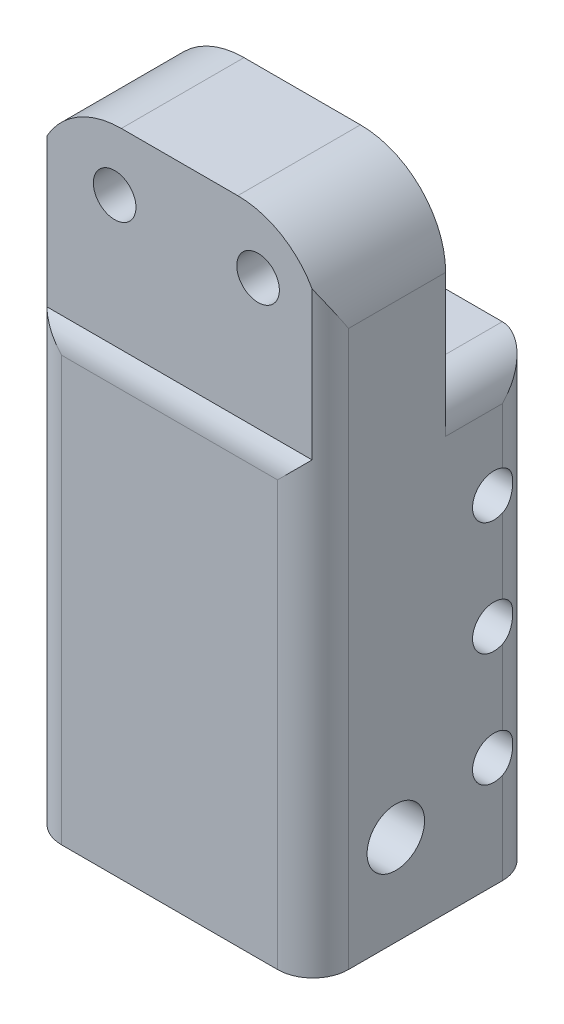
from build123d import *

# Parameters (mm, degrees)
CROQUIS1_W                 = 20.2
CROQUIS1_H                 = 15.83
SALIENTE_EXTRUIR1_DEPTH    = 31.6
CORTAR_EXTRUIR4_DEPTH      = 31.6
CORTAR_EXTRUIR5_DEPTH      = 35.649242416
CORTAR_EXTRUIR6_DEPTH      = 35.649242416
CORTAR_EXTRUIR6_DEPTH_BACK = 35.649242416
CROQUIS5_R                 = 2.025
CROQUIS6_R                 = 1.5
CORTAR_EXTRUIR7_DEPTH      = 39.814945709
CROQUIS10_W                = 20.2
CROQUIS10_H                = 8.639055001
SALIENTE_EXTRUIR4_DEPTH    = 13.5
CORTAR_EXTRUIR8_REACH      = 50.631
CROQUIS11_R                = 1.5
REDONDEO2_START            = -1
REDONDEO2_DEPTH            = 47
REDONDEO2_START_2          = -10
REDONDEO2_2_DEPTH          = 20
REDONDEO2_START_3          = -11
REDONDEO2_3_DEPTH          = 7.490944999
REDONDEO3_R                = 6


with BuildPart() as part:
    # Croquis1 → Saliente-Extruir1 (new body)
    with BuildSketch(Plane(origin=(0, 0, 0), x_dir=(1, 0, 0), z_dir=(0, 1, 0))):
        with Locations((0, 2.085)):
            Rectangle(CROQUIS1_W, CROQUIS1_H)
    extrude(amount=SALIENTE_EXTRUIR1_DEPTH)

    # Croquis2 → Cortar-Extruir4 (cut)
    with BuildSketch(Plane.XZ):
        with BuildLine():
            Line((2.78, 2.634482871), (2.78, -2.634482871))
            ThreePointArc((2.78, -2.634482871), (-3.83, 0), (2.78, 2.634482871))
        make_face()
    extrude(amount=-CORTAR_EXTRUIR4_DEPTH, mode=Mode.SUBTRACT)

    # Croquis4 → Cortar-Extruir5 (cut, through all)
    with BuildSketch(Plane.XZ):
        with BuildLine():
            Line((-0.4, -10), (-0.4, -3.809055001))
            ThreePointArc((-0.4, -3.809055001), (0, -3.83), (0.4, -3.809055001))
            Line((0.4, -3.809055001), (0.4, -10))
            Line((0.4, -10), (-0.4, -10))
        make_face()
    extrude(amount=-CORTAR_EXTRUIR5_DEPTH, mode=Mode.SUBTRACT)

    # Croquis5 → Cortar-Extruir6 (cut, two sides: drawn at the far end of the back side and taken through both)
    with BuildSketch(Plane(origin=(0, 0, 0), x_dir=(0, 0, -1), z_dir=(1, 0, 0)).offset(-CORTAR_EXTRUIR6_DEPTH_BACK)):
        with Locations((0, 6.405)):
            Circle(CROQUIS5_R)
    extrude(amount=CORTAR_EXTRUIR6_DEPTH + CORTAR_EXTRUIR6_DEPTH_BACK, mode=Mode.SUBTRACT)

    # Croquis6 → Cortar-Extruir7 (cut, through all)
    with BuildSketch(Plane(origin=(10.1, 0, 0), x_dir=(0, 0, -1), z_dir=(1, 0, 0))):
        with Locations((6.9045275, 23.8)):
            Circle(CROQUIS6_R)
        with Locations((6.9045275, 15.8)):
            Circle(CROQUIS6_R)
        with Locations((6.9045275, 7.8)):
            Circle(CROQUIS6_R)
    extrude(amount=-CORTAR_EXTRUIR7_DEPTH, mode=Mode.SUBTRACT)

    # Croquis10 → Saliente-Extruir4 (add)
    with BuildSketch(Plane(origin=(0, 31.6, 0), x_dir=(1, 0, 0), z_dir=(0, 1, 0))):
        with Locations((0, -0.810472499)):
            Rectangle(CROQUIS10_W, CROQUIS10_H)
    extrude(amount=SALIENTE_EXTRUIR4_DEPTH)

    # Croquis11 → Cortar-Extruir8 (cut, up to next)
    with BuildSketch(Plane.XY.offset(5.13), mode=Mode.PRIVATE) as cortar_extruir8_sk1:
        with Locations((-4.57, 40.8)):
            Circle(CROQUIS11_R)
    cortar_extruir8_tool1 = extrude(cortar_extruir8_sk1.sketch, amount=-CORTAR_EXTRUIR8_REACH, mode=Mode.PRIVATE) & part.part
    # Croquis11 → Cortar-Extruir8 (cut, up to next)
    with BuildSketch(Plane.XY.offset(5.13), mode=Mode.PRIVATE) as cortar_extruir8_sk2:
        with Locations((5.53, 40.8)):
            Circle(CROQUIS11_R)
    cortar_extruir8_tool2 = extrude(cortar_extruir8_sk2.sketch, amount=-CORTAR_EXTRUIR8_REACH, mode=Mode.PRIVATE) & part.part
    add(cortar_extruir8_tool1.solids().sort_by_distance((-4.57, 40.8, 5.13))[0], mode=Mode.SUBTRACT)
    add(cortar_extruir8_tool2.solids().sort_by_distance((5.53, 40.8, 5.13))[0], mode=Mode.SUBTRACT)

    # Redondeo2: read off the stored shape, not the designer's step
    # Redondeo2 outline → Redondeo2 (cut)
    with BuildSketch(Plane(origin=(0, 0, 0), x_dir=(1, 0, 0), z_dir=(0, 1, 0)).offset(REDONDEO2_START)):
        with BuildLine():
            Line((-10.1, -5.83), (-7.6, -5.83))
            ThreePointArc((-7.6, -5.83), (-9.367766953, -5.097766953), (-10.1, -3.33))
            Line((-10.1, -3.33), (-10.1, -5.83))
        make_face()
        with BuildLine():
            ThreePointArc((7.6, 10), (9.367766953, 9.267766953), (10.1, 7.5))
            Line((10.1, 7.5), (10.1, 10))
            Line((10.1, 10), (7.6, 10))
        make_face()
        with BuildLine():
            ThreePointArc((10.1, -3.33), (9.367766953, -5.097766953), (7.6, -5.83))
            Line((7.6, -5.83), (10.1, -5.83))
            Line((10.1, -5.83), (10.1, -3.33))
        make_face()
        with BuildLine():
            Line((-10.1, 10), (-10.1, 7.5))
            ThreePointArc((-10.1, 7.5), (-9.367766953, 9.267766953), (-7.6, 10))
            Line((-7.6, 10), (-10.1, 10))
        make_face()
    extrude(amount=REDONDEO2_DEPTH, mode=Mode.SUBTRACT)

    # Redondeo2 2 outline → Redondeo2 2 (cut)
    with BuildSketch(Plane.YZ.offset(REDONDEO2_START_2)):
        with BuildLine():
            ThreePointArc((29.865064843, 5.83), (30.80047919, 5.648404624), (31.6, 5.13))
            Line((31.6, 5.13), (31.6, 5.83))
            Line((31.6, 5.83), (29.865064843, 5.83))
        make_face()
    extrude(amount=REDONDEO2_2_DEPTH, mode=Mode.SUBTRACT)

    # Redondeo2 3 outline → Redondeo2 3 (cut)
    with BuildSketch(Plane.XY.offset(REDONDEO2_START_3)):
        with BuildLine():
            Line((10.1, 31.6), (7.6, 31.6))
            ThreePointArc((7.6, 31.6), (9.367766953, 30.867766953), (10.1, 29.1))
            Line((10.1, 29.1), (10.1, 31.6))
        make_face()
        with BuildLine():
            ThreePointArc((-10.1, 29.1), (-9.367766953, 30.867766953), (-7.6, 31.6))
            Line((-7.6, 31.6), (-10.1, 31.6))
            Line((-10.1, 31.6), (-10.1, 29.1))
        make_face()
    extrude(amount=REDONDEO2_3_DEPTH, mode=Mode.SUBTRACT)

    # Redondeo3
    # the kernel refuses this fillet: 6 mm, written as the material it takes off along each edge
    with BuildSketch(Plane(origin=(-10.1, 45.1, 18.33), x_dir=(1, 0, 0), z_dir=(0, 0, -1))) as redondeo3_piece_1:
        with BuildLine():
            CenterArc((REDONDEO3_R, REDONDEO3_R), REDONDEO3_R, 180, 90)
            Line((0, REDONDEO3_R), (0, 0))
            Line((0, 0), (REDONDEO3_R, 0))
        make_face()
    extrude(amount=36.839055001, mode=Mode.SUBTRACT)
    with BuildSketch(Plane(origin=(10.1, 45.1, -18.509055001), x_dir=(0, -1, 0), z_dir=(0, 0, 1))) as redondeo3_piece_2:
        with BuildLine():
            CenterArc((REDONDEO3_R, -REDONDEO3_R), REDONDEO3_R, 90, 90)
            Line((0, -REDONDEO3_R), (0, 0))
            Line((0, 0), (REDONDEO3_R, 0))
        make_face()
    extrude(amount=36.839055001, mode=Mode.SUBTRACT)


solid = part.part
